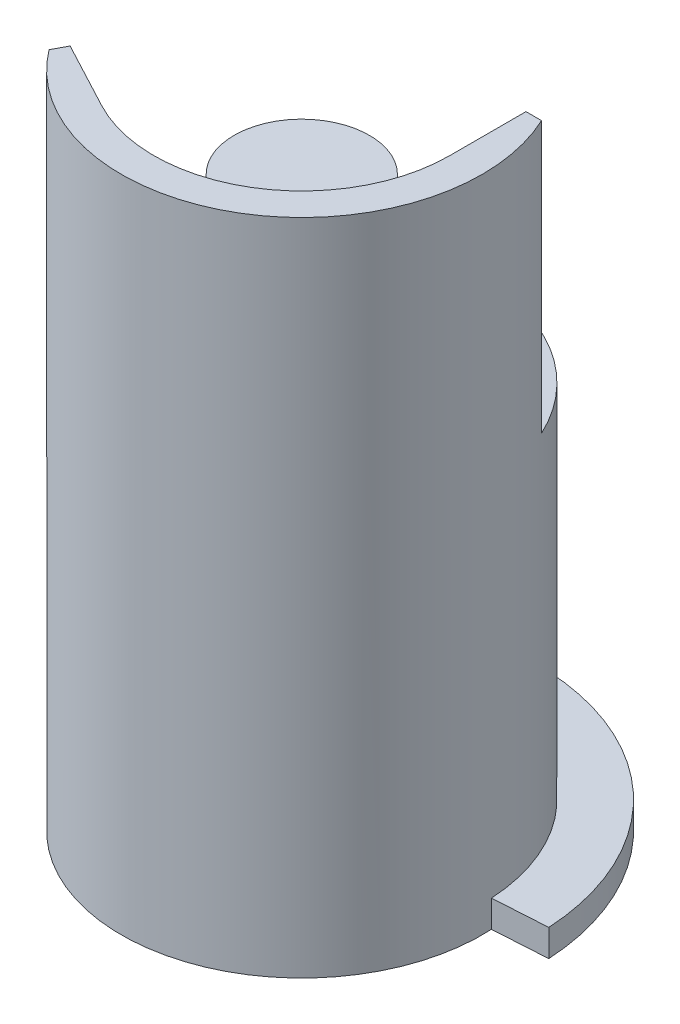
from build123d import *

# Parameters (mm, degrees)
SKETCH1_R           = 10
SKETCH1_R_2         = 7.636363636
BOSS_EXTRUDE1_DEPTH = 21.5
BOSS_EXTRUDE2_DEPTH = 15
SKETCH3_R           = 3.75
BOSS_EXTRUDE3_DEPTH = 10
BOSS_EXTRUDE4_DEPTH = 1.5
SKETCH6_W           = 32.555421104
SKETCH6_H           = 30.593451785
BOSS_EXTRUDE5_DEPTH = 1.5
SKETCH8_W           = 32.555421103
SKETCH8_H           = 30.593451785
CUT_EXTRUDE1_DEPTH  = 1.5


# Read off the part's stored shape, not the designer's step: Boss-Extrude4
with BuildPart() as part:
    # Sketch1 → Boss-Extrude1 (new body)
    # profile 1 of 2: a face of its own
    with BuildSketch(Plane(origin=(0, 0, 0), x_dir=(1, 0, 0), z_dir=(0, 1, 0))):
        with Locations(Location((0, 0, 0), (0, 0, 270))):
            Circle(SKETCH1_R)
        Circle(SKETCH1_R_2, mode=Mode.SUBTRACT)
    # profile 2 of 2: a face of its own
    with BuildSketch(Plane(origin=(0, 0, 0), x_dir=(1, 0, 0), z_dir=(0, 1, 0))):
        Circle(SKETCH1_R_2)
    extrude(amount=BOSS_EXTRUDE1_DEPTH)

    # Sketch2 → Boss-Extrude2 (add)
    with BuildSketch(Plane(origin=(0, 21.5, 0), x_dir=(1, 0, 0), z_dir=(0, 1, 0))):
        with BuildLine():
            ThreePointArc((3.849666815, -7.240170261), (-4.223312214, -7.028771866), (-8.2, 0))
            Line((-8.2, 0), (-10, 0))
            ThreePointArc((-10, 0), (-5.150380749, -8.571673007), (4.694715628, -8.829475929))
            Line((4.694715628, -8.829475929), (3.849666815, -7.240170261))
        make_face()
        with BuildLine():
            Line((7.578915355, -5.257293639), (3.849666815, -7.240170261))
            Line((3.849666815, -7.240170261), (4.694715628, -8.829475929))
            ThreePointArc((4.694715628, -8.829475929), (6.493411832, -7.604972241), (7.984663341, -6.020394615))
            Line((7.984663341, -6.020394615), (7.578915355, -5.257293639))
        make_face()
        with BuildLine():
            Line((-10, 0), (-8.2, 0))
            Line((-8.2, 0), (-8.2, 4.223635209))
            Line((-8.2, 4.223635209), (-9.064265311, 4.223635209))
            ThreePointArc((-9.064265311, 4.223635209), (-9.763264134, 2.163024144), (-10, 0))
        make_face()
    extrude(amount=BOSS_EXTRUDE2_DEPTH)

    # Sketch3 → Boss-Extrude3 (add)
    with BuildSketch(Plane(origin=(0, 21.5, 0), x_dir=(1, 0, 0), z_dir=(0, 1, 0))):
        with Locations(Location((0, 0, 0), (0, 0, 270))):
            Circle(SKETCH3_R)
    extrude(amount=BOSS_EXTRUDE3_DEPTH)

    # Boss-Extrude4 outline → Boss-Extrude4 (add)
    with BuildSketch(Plane(origin=(0, 0, 0), x_dir=(1, 0, 0), z_dir=(0, 1, 0))):
        with BuildLine():
            ThreePointArc((-0.680367431, 12.982183952), (-9.183045771, 9.201721054), (-12.980774925, 0.706740657))
            Line((-12.980774925, 0.706740657), (-9.986295348, 0.523359562))
            Line((-9.986295348, 0.523359562), (-1.440215285, 0))
            Line((-1.440215285, 0), (0, 0))
            Line((0, 0), (-0.523359562, 9.986295348))
            Line((-0.523359562, 9.986295348), (-0.680367431, 12.982183952))
        make_face()
    extrude(amount=BOSS_EXTRUDE4_DEPTH)

    # Sketch6 → Boss-Extrude5 (add)
    with BuildSketch(Plane.XZ):
        with Locations((-3.104949277, 0.730287835)):
            Rectangle(SKETCH6_W, SKETCH6_H)
    extrude(amount=BOSS_EXTRUDE5_DEPTH)


with BuildPart() as body_2:
    # Mirror6: mirrored copy
    add(part.part.mirror(Plane(origin=(13.172761275, -1.5, 16.027013728), x_dir=(0, 0, 1), z_dir=(-1, 0, 0))))

    # Sketch8 → Cut-Extrude1 (cut)
    with BuildSketch(Plane.XZ.offset(1.5)):
        with Locations((29.450471826, 0.730287835)):
            Rectangle(SKETCH8_W, SKETCH8_H)
    extrude(amount=-CUT_EXTRUDE1_DEPTH, mode=Mode.SUBTRACT)


solid = body_2.part
